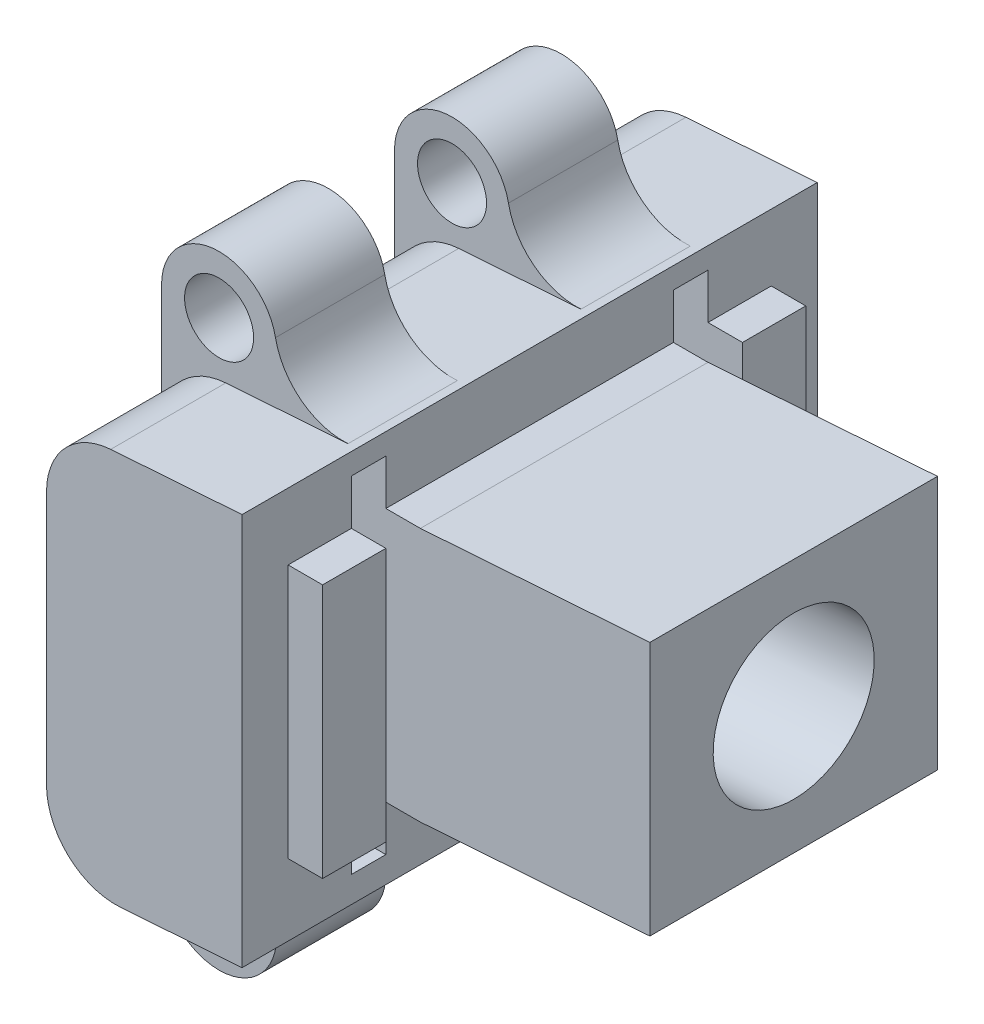
from build123d import *

# Parameters (mm, degrees)
SKETCH1_W                      = 50
SKETCH1_H                      = 34.11
BOSS_EXTRUDE1_DEPTH            = 20
SKETCH3_R                      = 3
BOSS_EXTRUDE2_DEPTH            = 9.5
LPATTERN1_COUNT                = 2
LPATTERN1_PITCH                = 20.25
MIRROR1_COPY_1_SKETCH_R        = 3
MIRROR1_COPY_1_DEPTH           = 9.5
BOSS_EXTRUDE3_REACH            = 71.611
CUT_EXTRUDE3_DEPTH             = 10
CUT_EXTRUDE4_START             = -19.5
CUT_EXTRUDE4_DEPTH             = 10.75
CUT_EXTRUDE5_START             = -39.75
CUT_EXTRUDE5_DEPTH             = 10.25
CUT_EXTRUDE6_DEPTH             = 50
SKETCH6_W                      = 3
SKETCH6_H                      = 30
CUT_EXTRUDE2_DEPTH             = 10
SKETCH10_W                     = 50
SKETCH10_H                     = 34.11
SKETCH10_W_2                   = 42
SKETCH10_H_2                   = 22.11
CUT_EXTRUDE7_DEPTH             = 3
CUT_EXTRUDE8_REACH             = 70.733
SKETCH11_W                     = 3
SKETCH11_H                     = 50
FILLET1_R                      = 6
SKETCH5_R                      = 7
CUT_EXTRUDE1_DEPTH             = 10
CUT_EXTRUDE1_DIRECTION_2_REACH = 44.371
SKETCH13_W                     = 25
SKETCH13_H                     = 22.11
SKETCH13_RX                    = 7.017093287
SKETCH13_RY                    = 7
BOSS_EXTRUDE4_DEPTH            = 20


with BuildPart() as part:
    # Sketch1 → Boss-Extrude1 (new body)
    with BuildSketch(Plane(origin=(0, 0, 0), x_dir=(0, 0, -1), z_dir=(1, 0, 0))):
        with Locations((25, 17.055)):
            Rectangle(SKETCH1_W, SKETCH1_H)
    extrude(amount=BOSS_EXTRUDE1_DEPTH)

    # Sketch3 → Boss-Extrude2 (add)
    with BuildSketch(Plane.XY.offset(-10)):
        with BuildLine():
            Line((0, 34.11), (0, 39.11))
            ThreePointArc((0, 39.11), (5, 44.11), (10, 39.11))
            Line((10, 39.11), (10, 34.11))
            Line((10, 34.11), (5, 34.11))
            Line((5, 34.11), (0, 34.11))
        make_face()
        with Locations((5, 39.11)):
            Circle(SKETCH3_R, mode=Mode.SUBTRACT)
    boss_extrude2 = extrude(amount=-BOSS_EXTRUDE2_DEPTH)

    # LPattern1: Boss-Extrude2 ×2
    with Locations(*[(0, 0, -i * LPATTERN1_PITCH) for i in range(1, LPATTERN1_COUNT)]):
        add(boss_extrude2)

    # Mirror1: Boss-Extrude2 across plane
    add(boss_extrude2.mirror(Plane.ZX.offset(17.055)))

    # Mirror1 copy 1 sketch → Mirror1 copy 1 (add)
    with BuildSketch(Plane(origin=(0, 34.11, -30.25), x_dir=(1, 0, 0), z_dir=(0, 0, 1))):
        with BuildLine():
            Line((0, -34.11), (0, -39.11))
            ThreePointArc((0, -39.11), (5, -44.11), (10, -39.11))
            Line((10, -39.11), (10, -34.11))
            Line((10, -34.11), (5, -34.11))
            Line((5, -34.11), (0, -34.11))
        make_face()
        with Locations((5, -39.11)):
            Circle(MIRROR1_COPY_1_SKETCH_R, mode=Mode.SUBTRACT)
    extrude(amount=-MIRROR1_COPY_1_DEPTH)

    # Boss-Extrude3: up to this face of the body (flat: up to its plane)
    boss_extrude3_end = Plane(part.part.faces().sort_by_distance((10, 17.055, -50))[0])
    # Sketch7 → Boss-Extrude3 (add, up to the picked face)
    with BuildSketch(Plane.XY, mode=Mode.PRIVATE) as boss_extrude3_sk1:
        Polygon((20, 34.11), (0, 34.11), (20, 35.508536239), align=None)
    boss_extrude3_tool1 = split(extrude(boss_extrude3_sk1.sketch, amount=-BOSS_EXTRUDE3_REACH, mode=Mode.PRIVATE), bisect_by=boss_extrude3_end, keep=Keep.BOTH, mode=Mode.PRIVATE)
    add(boss_extrude3_tool1.solids().sort_by(Axis((13.333333, 34.576179, 0), (0, 0, -1)))[0])

    # Sketch8 → Cut-Extrude3 (cut)
    with BuildSketch(Plane.XY):
        Polygon((0, 0), (20, 1.398536239), (20, 0), align=None)
    extrude(amount=-CUT_EXTRUDE3_DEPTH, mode=Mode.SUBTRACT)

    # Sketch8<2> → Cut-Extrude4 (cut)
    with BuildSketch(Plane.XY.offset(CUT_EXTRUDE4_START)):
        Polygon((0, 0), (20, 1.398536239), (20, 0), align=None)
    extrude(amount=-CUT_EXTRUDE4_DEPTH, mode=Mode.SUBTRACT)

    # Sketch8<3> → Cut-Extrude5 (cut)
    with BuildSketch(Plane.XY.offset(CUT_EXTRUDE5_START)):
        Polygon((0, 0), (20, 1.398536239), (20, 0), align=None)
    extrude(amount=-CUT_EXTRUDE5_DEPTH, mode=Mode.SUBTRACT)

    # Sketch9 → Cut-Extrude6 (cut)
    with BuildSketch(Plane.XY):
        Polygon((20, 1.398536239), (10, 0.699268119), (10, 0), (20, 0), align=None)
    extrude(amount=-CUT_EXTRUDE6_DEPTH, mode=Mode.SUBTRACT)

    # Sketch6 → Cut-Extrude2 (cut)
    with BuildSketch(Plane(origin=(20, 0, 0), x_dir=(0, 0, -1), z_dir=(1, 0, 0))):
        with Locations((11, 18.453536239)):
            Rectangle(SKETCH6_W, SKETCH6_H)
        with Locations((39, 18.453536239)):
            Rectangle(SKETCH6_W, SKETCH6_H)
    extrude(amount=-CUT_EXTRUDE2_DEPTH, mode=Mode.SUBTRACT)

    # Sketch10 → Cut-Extrude7 (cut)
    with BuildSketch(Plane(origin=(20, 0, 0), x_dir=(0, 0, -1), z_dir=(1, 0, 0))):
        with Locations((25, 18.453536239)):
            Rectangle(SKETCH10_W, SKETCH10_H)
        with Locations((25, 18.453536239)):
            Rectangle(SKETCH10_W_2, SKETCH10_H_2, mode=Mode.SUBTRACT)
    extrude(amount=-CUT_EXTRUDE7_DEPTH, mode=Mode.SUBTRACT)

    # Cut-Extrude8: up to this face of the body (flat: up to its plane)
    cut_extrude8_end = Plane(part.part.faces().sort_by_distance((11.172839506, 0.781281047, -25.029320988))[0])
    # Sketch11 → Cut-Extrude8 (cut, up to the picked face)
    with BuildSketch(Plane(origin=(0, 1.398536239, 0), x_dir=(1, 0, 0), z_dir=(0, 1, 0)), mode=Mode.PRIVATE) as cut_extrude8_sk1:
        with Locations((18.5, 25)):
            Rectangle(SKETCH11_W, SKETCH11_H)
    cut_extrude8_tool1 = split(extrude(cut_extrude8_sk1.sketch, amount=-CUT_EXTRUDE8_REACH, mode=Mode.PRIVATE), bisect_by=cut_extrude8_end, keep=Keep.BOTH, mode=Mode.PRIVATE)
    add(cut_extrude8_tool1.solids().sort_by(Axis((18.5, 1.398536, -25), (0, -1, 0)))[0], mode=Mode.SUBTRACT)

    # Fillet1
    # the kernel refuses this fillet: 6 mm, written as the material it adds along each edge
    with BuildSketch(Plane(origin=(10, 0.699268119, -10), x_dir=(0, -1, 0), z_dir=(0, 0, -1)), Plane(origin=(10, 0.699268119, -30.25), x_dir=(0, -1, 0), z_dir=(0, 0, -1))) as fillet1_piece_1:
        with BuildLine():
            CenterArc((FILLET1_R * 0.932515086138, -FILLET1_R), FILLET1_R, 90, 86)
            Line((-FILLET1_R * 0.0650489641222, -FILLET1_R * 0.930243526256), (0, 0))
            Line((0, 0), (FILLET1_R * 0.932515086138, 0))
        make_face()
    extrude(amount=9.5)
    with BuildSketch(Plane(origin=(10, 0.699268119, -10), x_dir=(0, -1, 0), z_dir=(0, 0, -1))) as fillet1_piece_2_section:
        with BuildLine():
            CenterArc((FILLET1_R * 0.932515086138, -FILLET1_R), FILLET1_R, 90, 86)
            Line((-FILLET1_R * 0.0650489641222, -FILLET1_R * 0.930243526256), (0, 0))
            Line((0, 0), (FILLET1_R * 0.932515086138, 0))
        make_face()
    fillet1_piece_2 = extrude(amount=23.487726292, mode=Mode.PRIVATE)
    fillet1_piece_2 = split(fillet1_piece_2, bisect_by=Plane(origin=(11.254012423, -0.470117383, -30.25), z_dir=(0, 0, -1)), keep=Keep.TOP, mode=Mode.PRIVATE)
    add(fillet1_piece_2)
    with BuildSketch(Plane(origin=(10, 0.699268119, -16.262273708), x_dir=(0, -1, 0), z_dir=(0, 0, -1))) as fillet1_piece_3_section:
        with BuildLine():
            CenterArc((FILLET1_R * 0.932515086138, -FILLET1_R), FILLET1_R, 90, 86)
            Line((-FILLET1_R * 0.0650489641222, -FILLET1_R * 0.930243526256), (0, 0))
            Line((0, 0), (FILLET1_R * 0.932515086138, 0))
        make_face()
    fillet1_piece_3 = extrude(amount=23.487726292, mode=Mode.PRIVATE)
    fillet1_piece_3 = split(fillet1_piece_3, bisect_by=Plane(origin=(11.254012423, -0.470117383, -19.5), z_dir=(0, 0, 1)), keep=Keep.TOP, mode=Mode.PRIVATE)
    add(fillet1_piece_3)
    with BuildSketch(Plane(origin=(10, 34.809268119, -39.75), x_dir=(-0.017789045338557734, 0.9998417624134045, 0), z_dir=(0, 0, 1)), Plane(origin=(10, 34.809268119, -19.5), x_dir=(-0.017789045338557734, 0.9998417624134045, 0), z_dir=(0, 0, 1))) as fillet1_piece_4:
        with BuildLine():
            CenterArc((6.31571957, -5.907243477), FILLET1_R, 100.087773501, 82.892935515)
            Line((0.323836974, -6.219241818), (-0.275351285, -6.250441652))
            Line((-0.275351285, -6.250441652), (-0.59918826, -0.031199834))
            Line((-0.59918826, -0.031199834), (0.010673427, 0.599905057))
            ThreePointArc((0.010673427, 0.599905057), (4.31072477, 0.523399143), (5.15968577, 0.590724348))
            Line((5.15968577, 0.590724348), (5.264779752, 0))
        make_face()
    extrude(amount=9.5)
    with BuildSketch(Plane(origin=(10, 34.809268119, -39.75), x_dir=(-0.017789045338557734, 0.9998417624134045, 0), z_dir=(0, 0, 1))) as fillet1_piece_5_section:
        with BuildLine():
            CenterArc((6.31571957, -5.907243477), FILLET1_R, 100.087773501, 82.892935515)
            Line((0.323836974, -6.219241818), (-0.275351285, -6.250441652))
            Line((-0.275351285, -6.250441652), (-0.59918826, -0.031199834))
            Line((-0.59918826, -0.031199834), (0.010673427, 0.599905057))
            ThreePointArc((0.010673427, 0.599905057), (4.31072477, 0.523399143), (5.15968577, 0.590724348))
            Line((5.15968577, 0.590724348), (5.264779752, 0))
        make_face()
    fillet1_piece_5 = extrude(amount=25.069168086, mode=Mode.PRIVATE)
    fillet1_piece_5 = split(fillet1_piece_5, bisect_by=Plane(origin=(11.504368247, 36.050278399, -19.5), z_dir=(0, 0, 1)), keep=Keep.TOP, mode=Mode.PRIVATE)
    add(fillet1_piece_5)
    with BuildSketch(Plane(origin=(10, 34.809268119, -35.069168086), x_dir=(-0.017789045338557734, 0.9998417624134045, 0), z_dir=(0, 0, 1))) as fillet1_piece_6_section:
        with BuildLine():
            CenterArc((6.31571957, -5.907243477), FILLET1_R, 100.087773501, 82.892935515)
            Line((0.323836974, -6.219241818), (-0.275351285, -6.250441652))
            Line((-0.275351285, -6.250441652), (-0.59918826, -0.031199834))
            Line((-0.59918826, -0.031199834), (0.010673427, 0.599905057))
            ThreePointArc((0.010673427, 0.599905057), (4.31072477, 0.523399143), (5.15968577, 0.590724348))
            Line((5.15968577, 0.590724348), (5.264779752, 0))
        make_face()
    fillet1_piece_6 = extrude(amount=25.069168086, mode=Mode.PRIVATE)
    fillet1_piece_6 = split(fillet1_piece_6, bisect_by=Plane(origin=(11.504368247, 36.050278399, -30.25), z_dir=(0, 0, -1)), keep=Keep.TOP, mode=Mode.PRIVATE)
    add(fillet1_piece_6)
    # the kernel refuses this fillet: 6 mm, written as the material it takes off along each edge
    with BuildSketch(Plane(origin=(0, 0, 16.08553065), x_dir=(0, 1, 0), z_dir=(0, 0, -1))) as fillet1_2_piece_1:
        with BuildLine():
            CenterArc((FILLET1_R * 1.07236871002, FILLET1_R), FILLET1_R, 176, 94)
            Line((FILLET1_R * 0.0748046597649, FILLET1_R * 1.06975647374), (0, 0))
            Line((0, 0), (FILLET1_R * 1.07236871002, 0))
        make_face()
    extrude(amount=26.08553065, mode=Mode.SUBTRACT)
    with BuildSketch(Plane(origin=(0, 0, 16.08553065), x_dir=(0, 1, 0), z_dir=(0, 0, -1))) as fillet1_2_piece_2_section:
        with BuildLine():
            CenterArc((FILLET1_R * 1.07236871002, FILLET1_R), FILLET1_R, 176, 94)
            Line((FILLET1_R * 0.0748046597649, FILLET1_R * 1.06975647374), (0, 0))
            Line((0, 0), (FILLET1_R * 1.07236871002, 0))
        make_face()
    fillet1_2_piece_2 = extrude(amount=42.171061301, mode=Mode.PRIVATE)
    fillet1_2_piece_2 = split(fillet1_2_piece_2, bisect_by=Plane(origin=(1.465256167, 1.571294865, -19.5), z_dir=(0, 0, -1)), keep=Keep.TOP, mode=Mode.PRIVATE)
    add(fillet1_2_piece_2, mode=Mode.SUBTRACT)
    with BuildSketch(Plane(origin=(0, 0, -3.41446935), x_dir=(0, 1, 0), z_dir=(0, 0, -1))) as fillet1_2_piece_3_section:
        with BuildLine():
            CenterArc((FILLET1_R * 1.07236871002, FILLET1_R), FILLET1_R, 176, 94)
            Line((FILLET1_R * 0.0748046597649, FILLET1_R * 1.06975647374), (0, 0))
            Line((0, 0), (FILLET1_R * 1.07236871002, 0))
        make_face()
    fillet1_2_piece_3 = extrude(amount=26.83553065, mode=Mode.PRIVATE)
    fillet1_2_piece_3 = split(fillet1_2_piece_3, bisect_by=Plane(origin=(1.465256167, 1.571294865, -10), z_dir=(0, 0, 1)), keep=Keep.TOP, mode=Mode.PRIVATE)
    add(fillet1_2_piece_3, mode=Mode.SUBTRACT)
    with BuildSketch(Plane(origin=(0, 0, -19.5), x_dir=(0, 1, 0), z_dir=(0, 0, -1))) as fillet1_2_piece_4:
        with BuildLine():
            CenterArc((FILLET1_R * 1.07236871002, FILLET1_R), FILLET1_R, 176, 94)
            Line((FILLET1_R * 0.0748046597649, FILLET1_R * 1.06975647374), (0, 0))
            Line((0, 0), (FILLET1_R * 1.07236871002, 0))
        make_face()
    extrude(amount=10.75, mode=Mode.SUBTRACT)
    with BuildSketch(Plane(origin=(0, 0, -19.5), x_dir=(0, 1, 0), z_dir=(0, 0, -1))) as fillet1_2_piece_5_section:
        with BuildLine():
            CenterArc((FILLET1_R * 1.07236871002, FILLET1_R), FILLET1_R, 176, 94)
            Line((FILLET1_R * 0.0748046597649, FILLET1_R * 1.06975647374), (0, 0))
            Line((0, 0), (FILLET1_R * 1.07236871002, 0))
        make_face()
    fillet1_2_piece_5 = extrude(amount=26.83553065, mode=Mode.PRIVATE)
    fillet1_2_piece_5 = split(fillet1_2_piece_5, bisect_by=Plane(origin=(1.465256167, 1.571294865, -39.75), z_dir=(0, 0, -1)), keep=Keep.TOP, mode=Mode.PRIVATE)
    add(fillet1_2_piece_5, mode=Mode.SUBTRACT)
    with BuildSketch(Plane(origin=(0, 0, -23.66446935), x_dir=(0, 1, 0), z_dir=(0, 0, -1))) as fillet1_2_piece_6_section:
        with BuildLine():
            CenterArc((FILLET1_R * 1.07236871002, FILLET1_R), FILLET1_R, 176, 94)
            Line((FILLET1_R * 0.0748046597649, FILLET1_R * 1.06975647374), (0, 0))
            Line((0, 0), (FILLET1_R * 1.07236871002, 0))
        make_face()
    fillet1_2_piece_6 = extrude(amount=42.421061301, mode=Mode.PRIVATE)
    fillet1_2_piece_6 = split(fillet1_2_piece_6, bisect_by=Plane(origin=(1.465256167, 1.571294865, -30.25), z_dir=(0, 0, 1)), keep=Keep.TOP, mode=Mode.PRIVATE)
    add(fillet1_2_piece_6, mode=Mode.SUBTRACT)
    with BuildSketch(Plane(origin=(0, 0, -39.75), x_dir=(0, 1, 0), z_dir=(0, 0, -1))) as fillet1_2_piece_7:
        with BuildLine():
            CenterArc((FILLET1_R * 1.07236871002, FILLET1_R), FILLET1_R, 176, 94)
            Line((FILLET1_R * 0.0748046597649, FILLET1_R * 1.06975647374), (0, 0))
            Line((0, 0), (FILLET1_R * 1.07236871002, 0))
        make_face()
    extrude(amount=26.33553065, mode=Mode.SUBTRACT)
    with BuildSketch(Plane(origin=(0, 34.11, -63.987726292), x_dir=(0, -1, 0), z_dir=(0, 0, 1))) as fillet1_2_piece_8:
        with BuildLine():
            CenterArc((FILLET1_R * 0.932515086138, FILLET1_R), FILLET1_R, 184, 86)
            Line((-FILLET1_R * 0.0650489641222, FILLET1_R * 0.930243526256), (0, 0))
            Line((0, 0), (FILLET1_R * 0.932515086138, 0))
        make_face()
    extrude(amount=24.237726292, mode=Mode.SUBTRACT)
    with BuildSketch(Plane(origin=(0, 34.11, -63.987726292), x_dir=(0, -1, 0), z_dir=(0, 0, 1))) as fillet1_2_piece_9_section:
        with BuildLine():
            CenterArc((FILLET1_R * 0.932515086138, FILLET1_R), FILLET1_R, 184, 86)
            Line((-FILLET1_R * 0.0650489641222, FILLET1_R * 0.930243526256), (0, 0))
            Line((0, 0), (FILLET1_R * 0.932515086138, 0))
        make_face()
    fillet1_2_piece_9 = extrude(amount=38.225452584, mode=Mode.PRIVATE)
    fillet1_2_piece_9 = split(fillet1_2_piece_9, bisect_by=Plane(origin=(1.254012423, 32.940614497, -30.25), z_dir=(0, 0, 1)), keep=Keep.TOP, mode=Mode.PRIVATE)
    add(fillet1_2_piece_9, mode=Mode.SUBTRACT)
    with BuildSketch(Plane(origin=(0, 34.11, -44.237726292), x_dir=(0, -1, 0), z_dir=(0, 0, 1))) as fillet1_2_piece_10_section:
        with BuildLine():
            CenterArc((FILLET1_R * 0.932515086138, FILLET1_R), FILLET1_R, 184, 86)
            Line((-FILLET1_R * 0.0650489641222, FILLET1_R * 0.930243526256), (0, 0))
            Line((0, 0), (FILLET1_R * 0.932515086138, 0))
        make_face()
    fillet1_2_piece_10 = extrude(amount=24.737726292, mode=Mode.PRIVATE)
    fillet1_2_piece_10 = split(fillet1_2_piece_10, bisect_by=Plane(origin=(1.254012423, 32.940614497, -39.75), z_dir=(0, 0, -1)), keep=Keep.TOP, mode=Mode.PRIVATE)
    add(fillet1_2_piece_10, mode=Mode.SUBTRACT)
    with BuildSketch(Plane(origin=(0, 34.11, -30.25), x_dir=(0, -1, 0), z_dir=(0, 0, 1))) as fillet1_2_piece_11:
        with BuildLine():
            CenterArc((FILLET1_R * 0.932515086138, FILLET1_R), FILLET1_R, 184, 86)
            Line((-FILLET1_R * 0.0650489641222, FILLET1_R * 0.930243526256), (0, 0))
            Line((0, 0), (FILLET1_R * 0.932515086138, 0))
        make_face()
    extrude(amount=10.75, mode=Mode.SUBTRACT)
    with BuildSketch(Plane(origin=(0, 34.11, -30.25), x_dir=(0, -1, 0), z_dir=(0, 0, 1))) as fillet1_2_piece_12_section:
        with BuildLine():
            CenterArc((FILLET1_R * 0.932515086138, FILLET1_R), FILLET1_R, 184, 86)
            Line((-FILLET1_R * 0.0650489641222, FILLET1_R * 0.930243526256), (0, 0))
            Line((0, 0), (FILLET1_R * 0.932515086138, 0))
        make_face()
    fillet1_2_piece_12 = extrude(amount=24.737726292, mode=Mode.PRIVATE)
    fillet1_2_piece_12 = split(fillet1_2_piece_12, bisect_by=Plane(origin=(1.254012423, 32.940614497, -10), z_dir=(0, 0, 1)), keep=Keep.TOP, mode=Mode.PRIVATE)
    add(fillet1_2_piece_12, mode=Mode.SUBTRACT)
    with BuildSketch(Plane(origin=(0, 34.11, -23.987726292), x_dir=(0, -1, 0), z_dir=(0, 0, 1))) as fillet1_2_piece_13_section:
        with BuildLine():
            CenterArc((FILLET1_R * 0.932515086138, FILLET1_R), FILLET1_R, 184, 86)
            Line((-FILLET1_R * 0.0650489641222, FILLET1_R * 0.930243526256), (0, 0))
            Line((0, 0), (FILLET1_R * 0.932515086138, 0))
        make_face()
    fillet1_2_piece_13 = extrude(amount=37.975452584, mode=Mode.PRIVATE)
    fillet1_2_piece_13 = split(fillet1_2_piece_13, bisect_by=Plane(origin=(1.254012423, 32.940614497, -19.5), z_dir=(0, 0, -1)), keep=Keep.TOP, mode=Mode.PRIVATE)
    add(fillet1_2_piece_13, mode=Mode.SUBTRACT)
    with BuildSketch(Plane(origin=(0, 34.11, -10), x_dir=(0, -1, 0), z_dir=(0, 0, 1))) as fillet1_2_piece_14:
        with BuildLine():
            CenterArc((FILLET1_R * 0.932515086138, FILLET1_R), FILLET1_R, 184, 86)
            Line((-FILLET1_R * 0.0650489641222, FILLET1_R * 0.930243526256), (0, 0))
            Line((0, 0), (FILLET1_R * 0.932515086138, 0))
        make_face()
    extrude(amount=23.987726292, mode=Mode.SUBTRACT)

    # Sketch5 → Cut-Extrude1 (cut)
    with BuildSketch(Plane(origin=(20, 17.754268119, -25), x_dir=(0, 0, -1), z_dir=(0.9975640502598249, 0.06975647374411839, 0))):
        with Locations(Location((0, 0.697564737, 0), (0, 0, 270))):
            Circle(SKETCH5_R)
    extrude(amount=-CUT_EXTRUDE1_DEPTH, mode=Mode.SUBTRACT)

    # Sketch5 → Cut-Extrude1 direction 2 (cut, up to next)
    with BuildSketch(Plane(origin=(20, 17.754268119, -25), x_dir=(0, 0, -1), z_dir=(0.9975640502598249, 0.06975647374411839, 0)), mode=Mode.PRIVATE) as cut_extrude1_direction_2_sk1:
        with Locations(Location((0, 0.697564737, 0), (0, 0, 270))):
            Circle(SKETCH5_R)
    cut_extrude1_direction_2_tool1 = extrude(cut_extrude1_direction_2_sk1.sketch, amount=CUT_EXTRUDE1_DIRECTION_2_REACH, mode=Mode.PRIVATE) & part.part
    add(cut_extrude1_direction_2_tool1.solids().sort_by_distance((19.95134, 18.450134, -25))[0], mode=Mode.SUBTRACT)

    # Sketch13 → Boss-Extrude4 (add, along a direction that is not the sketch's normal)
    with BuildSketch(Plane(origin=(20, 0, 0), x_dir=(0, 0, -1), z_dir=(1, 0, 0))):
        with Locations((25, 18.453536239)):
            Rectangle(SKETCH13_W, SKETCH13_H)
        with Locations(Location((25, 18.453536239), (0, 0, -90))):
            Ellipse(SKETCH13_RX, SKETCH13_RY, mode=Mode.SUBTRACT)
    extrude(amount=BOSS_EXTRUDE4_DEPTH, dir=(0.9975640502598249, 0.0697564737441187, 0))


solid = part.part
